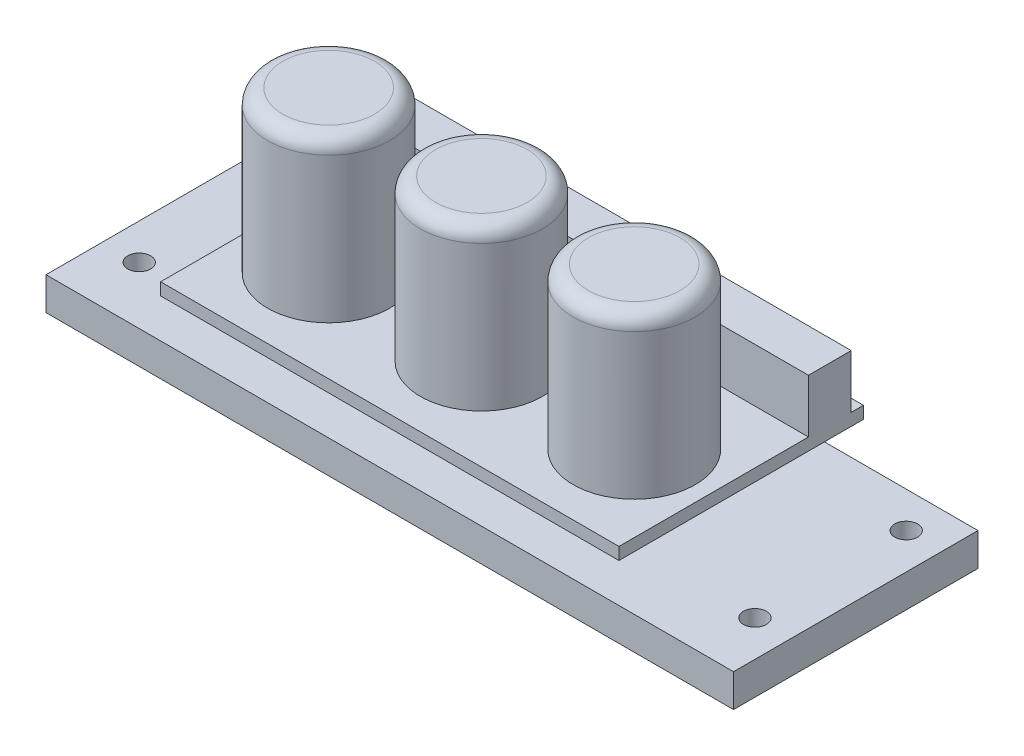
from build123d import *

# Parameters (mm, degrees)
SKETCH2_W                = 90
SKETCH2_H                = 32
SKETCH2_R                = 1.5
BOSS_EXTRUDE1_DEPTH      = 4.3
SKETCH3_W                = 60
SKETCH3_H                = 32
BOSS_EXTRUDE2_DEPTH      = 1.6
SKETCH4_R                = 8
BOSS_EXTRUDE3_DEPTH      = 21
FILLET1_R                = 2
BOSS_EXTRUDE4_DEPTH      = 30
BOSS_EXTRUDE4_DEPTH_BACK = 30
SKETCH5_W                = 5.6
SKETCH5_H                = 7


with BuildPart() as part:
    # Sketch2 → Boss-Extrude1 (new body)
    with BuildSketch(Plane(origin=(0, 0, 0), x_dir=(1, 0, 0), z_dir=(0, 1, 0))):
        Rectangle(SKETCH2_W, SKETCH2_H)
        with Locations((40.3, 11.3)):
            Circle(SKETCH2_R, mode=Mode.SUBTRACT)
        with Locations((40.3, -8.5)):
            Circle(SKETCH2_R, mode=Mode.SUBTRACT)
        with Locations((-40.3, -8.5)):
            Circle(SKETCH2_R, mode=Mode.SUBTRACT)
        with Locations((-40.3, 11.3)):
            Circle(SKETCH2_R, mode=Mode.SUBTRACT)
    extrude(amount=BOSS_EXTRUDE1_DEPTH)


with BuildPart() as body_2:
    # Sketch3 → Boss-Extrude2 (new body)
    with BuildSketch(Plane(origin=(0, 9.4, 0), x_dir=(1, 0, 0), z_dir=(0, 1, 0))):
        Rectangle(SKETCH3_W, SKETCH3_H)
    extrude(amount=BOSS_EXTRUDE2_DEPTH)

    # Sketch4 → Boss-Extrude3 (add)
    with BuildSketch(Plane(origin=(0, 11, 0), x_dir=(1, 0, 0), z_dir=(0, 1, 0))):
        with Locations((20, -4)):
            Circle(SKETCH4_R)
        with Locations((0, -4)):
            Circle(SKETCH4_R)
        with Locations((-20, -4)):
            Circle(SKETCH4_R)
    extrude(amount=BOSS_EXTRUDE3_DEPTH)

    # Fillet1
    fillet1_edges = [body_2.edges().sort_by_distance(p)[0] for p in [
        (-28, 32, 4),
        (12, 32, 4),
        (-8, 32, 4),
    ]]
    fillet(fillet1_edges, radius=FILLET1_R)

    # Sketch5 → Boss-Extrude4 (add, two sides: drawn at the far end of the back side and taken through both)
    with BuildSketch(Plane(origin=(0, 0, 0), x_dir=(0, 0, -1), z_dir=(1, 0, 0)).offset(-BOSS_EXTRUDE4_DEPTH_BACK)):
        with Locations((11.607185034, 14.5)):
            Rectangle(SKETCH5_W, SKETCH5_H)
    extrude(amount=BOSS_EXTRUDE4_DEPTH + BOSS_EXTRUDE4_DEPTH_BACK)


solid = Compound([part.part, body_2.part])
